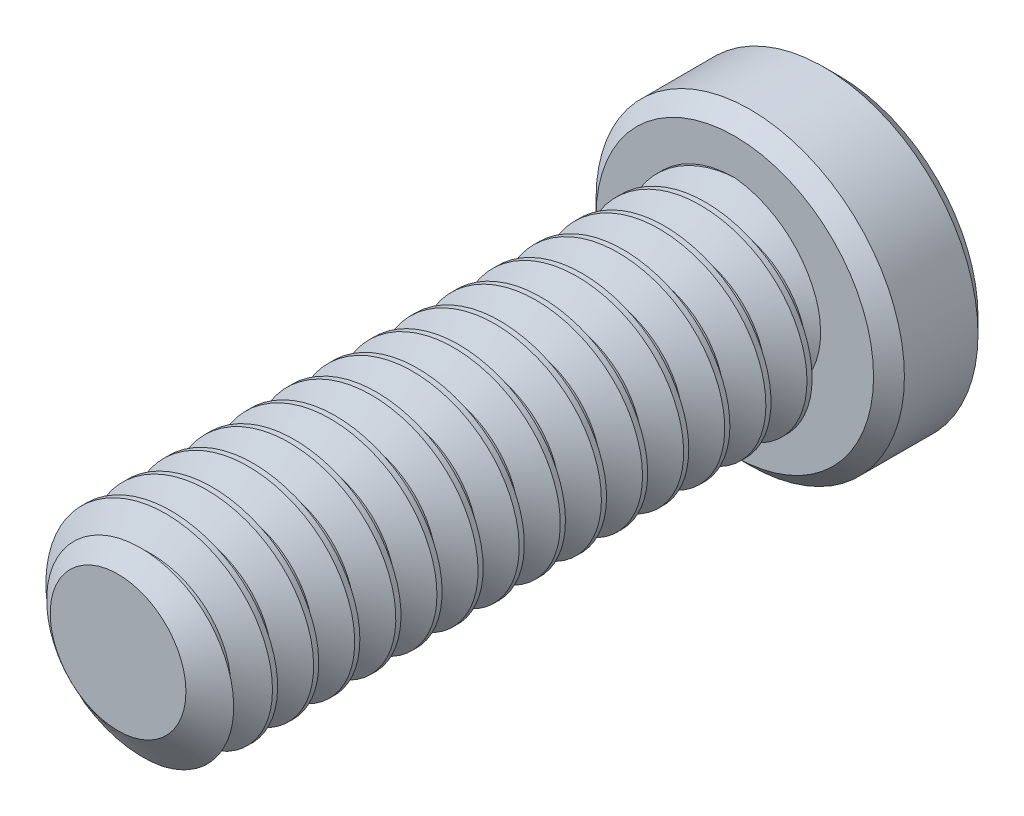
from build123d import *

# Parameters (mm, degrees)
SKETCH1_R          = 3.175
EXTRUDE1_DEPTH     = 19.05
CUT_SWEEP1_PITCH   = 1.27
SKETCH6_R          = 4.7625
EXTRUDE2_DEPTH     = 3.2258
CUT_EXTRUDE1_DEPTH = 2.38125
CHAMFER1_SIZE      = 0.47625


with BuildPart() as part:
    # Sketch1 → Extrude1 (new body)
    with BuildSketch(Plane.XY):
        Circle(SKETCH1_R)
    extrude(amount=-EXTRUDE1_DEPTH)

    # Cut-Sweep1: the profile of Sketch3 profile screwed along a right-hand helix of 16 turns, 6 arcs to a turn; built about Z, then put on its axis
    cut_sweep1_z = Axis((0, 0, 0), (0, 0, 1))
    cut_sweep1_corners = [(3.1753, 0, -1.111423205), (2.350110803, 0, -0.635), (2.350110803, 0, -0.47625), (3.1753, 0, 0.000173205)]
    with BuildLine(mode=Mode.PRIVATE) as cut_sweep1_profile:
        Line(cut_sweep1_corners[0], cut_sweep1_corners[1])
        Line(cut_sweep1_corners[1], cut_sweep1_corners[2])
        Line(cut_sweep1_corners[2], cut_sweep1_corners[3])
        Line(cut_sweep1_corners[3], cut_sweep1_corners[0])
    cut_sweep1_cap = Face(cut_sweep1_profile.wire())
    cut_sweep1_turn_angles = [0, 30, 60, 90, 120, 150, 180, 210, 240, 270, 300, 330, 360]
    cut_sweep1_turn_weights = [1, 0.8660254037844387, 1, 0.8660254037844387, 1, 0.8660254037844387, 1, 0.8660254037844387, 1, 0.8660254037844387, 1, 0.8660254037844387, 1]
    cut_sweep1_turn_rails = [Edge.make_bspline([Vector(p[0], p[1], 0).rotate(cut_sweep1_z, cut_sweep1_turn_angles[k]) / cut_sweep1_turn_weights[k] + Vector(0, 0, p[2] + CUT_SWEEP1_PITCH * cut_sweep1_turn_angles[k] / 360) for k in range(13)], [0, 0, 0, 1, 1, 2, 2, 3, 3, 4, 4, 5, 5, 6, 6, 6], 2, cut_sweep1_turn_weights) for p in cut_sweep1_corners]
    cut_sweep1_turn_sides = [Face.make_surface_from_curves(cut_sweep1_turn_rails[p[0]], cut_sweep1_turn_rails[p[1]]) for p in [(0, 1), (1, 2), (2, 3), (3, 0)]]
    cut_sweep1 = Plane(origin=(0, 0, 0), x_dir=(0, 1, 0), z_dir=(0, 0, -1)) * Solid(Shell([*[p.moved(Location((0, 0, CUT_SWEEP1_PITCH * i))) for i in range(16) for p in cut_sweep1_turn_sides], cut_sweep1_cap, cut_sweep1_cap.rotate(cut_sweep1_z, 5760).moved(Location((0, 0, CUT_SWEEP1_PITCH * 5760 / 360)))]))
    add(cut_sweep1, mode=Mode.SUBTRACT)

    # Sketch4 → Cut-Revolve1 (revolve, cut)
    with BuildSketch(Plane(origin=(0, 0, 0), x_dir=(0, 0, -1), z_dir=(1, 0, 0)), mode=Mode.PRIVATE) as cut_revolve1_sk:
        Polygon((0.755446349, 3.175), (0, 2.096110803), (0, 3.175), align=None)
    revolve(cut_revolve1_sk.sketch.rotate(Axis((0, 0, 0), (0, 0, -1)), 229.892048011), axis=Axis((0, 0, 0), (0, 0, -1)), mode=Mode.SUBTRACT)

    # Sketch6 → Extrude2 (add)
    with BuildSketch(Plane(origin=(0, 0, -19.05), x_dir=(-1, 0, 0), z_dir=(0, 0, -1))):
        Circle(SKETCH6_R)
    extrude(amount=EXTRUDE2_DEPTH)

    # Sketch7 → Cut-Extrude1 (cut)
    with BuildSketch(Plane(origin=(0, 0, -22.2758), x_dir=(-1, 0, 0), z_dir=(0, 0, -1))):
        Polygon((0, 1.833087105), (-1.5875, 0.916543552), (-1.5875, -0.916543552), (0, -1.833087105), (1.5875, -0.916543552), (1.5875, 0.916543552), align=None)
    extrude(amount=-CUT_EXTRUDE1_DEPTH, mode=Mode.SUBTRACT)

    # Cut-Extrude2 cone 1 section (through the dimple's axis) → Cut-Extrude2 (revolve, cut)
    with BuildSketch(Plane(origin=(0, 0, -22.2758), x_dir=(0, 1, 0), z_dir=(1, 0, 0))):
        Polygon((0, 0), (1.833087105, 0), (0, 1.833087105), align=None)
    revolve(axis=Axis((0, 0, -22.2758), (0, 0, 1)), mode=Mode.SUBTRACT)

    # Chamfer1
    chamfer1_edges = [part.edges().sort_by_distance(p)[0] for p in [
        (4.7625, 0, -19.05),
        (4.7625, 0, -22.2758),
    ]]
    chamfer(chamfer1_edges, length=CHAMFER1_SIZE)


solid = part.part
